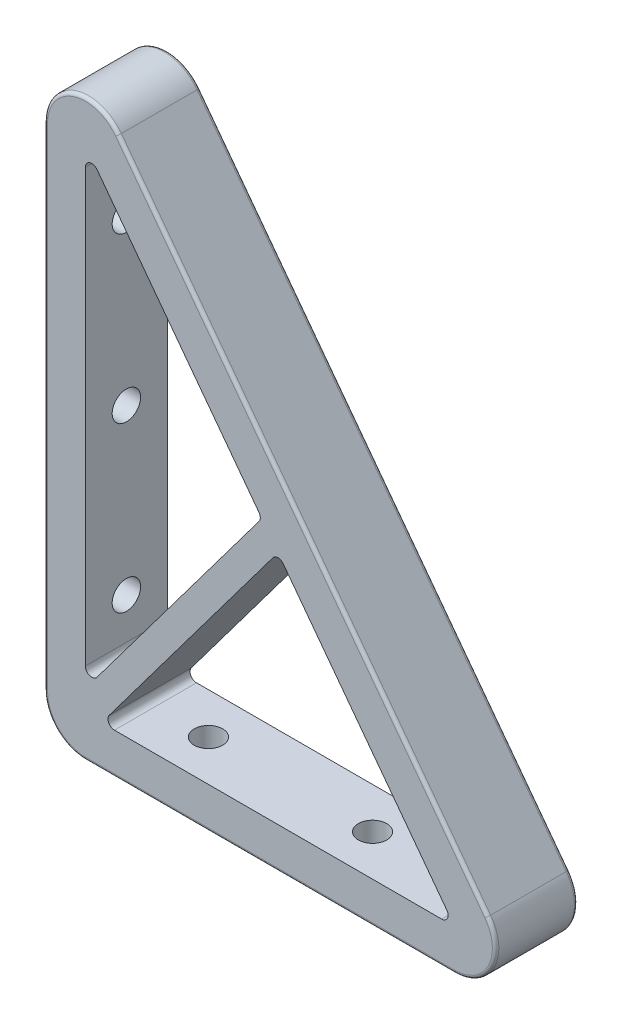
from build123d import *

# Parameters (mm, degrees)
BOSS_EXTRUDE1_DEPTH = 12.7
FILLET1_R           = 6.35
FILLET2_R           = 1
CUT_EXTRUDE1_REACH  = 115.77
SKETCH2_R           = 2.2
CUT_EXTRUDE2_REACH  = 125.947
SKETCH3_R           = 2.2
FILLET3_R           = 0.5


with BuildPart() as part:
    # Sketch1 → Boss-Extrude1 (new body)
    with BuildSketch(Plane.XY):
        Polygon((76.2, -101.6), (0, 0), (0, -101.6), align=None)
        Polygon((6.35, -91.916666667), (6.35, -19.05), (33.675, -55.483333333), align=None, mode=Mode.SUBTRACT)
        Polygon((63.5, -95.25), (8.85, -95.25), (36.175, -58.816666667), align=None, mode=Mode.SUBTRACT)
    extrude(amount=BOSS_EXTRUDE1_DEPTH)

    # Fillet1
    fillet1_edges = [part.edges().sort_by_distance(p)[0] for p in [
        (0, 0, 6.35),
        (76.2, -101.6, 6.35),
        (0, -101.6, 6.35),
    ]]
    fillet(fillet1_edges, radius=FILLET1_R)

    # Fillet2
    fillet2_edges = [part.edges().sort_by_distance(p)[0] for p in [
        (63.5, -95.25, 6.35),
        (6.35, -19.05, 6.35),
        (36.175, -58.816666667, 6.35),
        (33.675, -55.483333333, 6.35),
        (6.35, -91.916666667, 6.35),
        (8.85, -95.25, 6.35),
    ]]
    fillet(fillet2_edges, radius=FILLET2_R)

    # Sketch2 → Cut-Extrude1 (cut, up to next)
    with BuildSketch(Plane.XZ.offset(101.6), mode=Mode.PRIVATE) as cut_extrude1_sk1:
        with Locations((19.05, 6.35)):
            Circle(SKETCH2_R)
    cut_extrude1_tool1 = extrude(cut_extrude1_sk1.sketch, amount=-CUT_EXTRUDE1_REACH, mode=Mode.PRIVATE) & part.part
    # Sketch2 → Cut-Extrude1 (cut, up to next)
    with BuildSketch(Plane.XZ.offset(101.6), mode=Mode.PRIVATE) as cut_extrude1_sk2:
        with Locations((44.45, 6.35)):
            Circle(SKETCH2_R)
    cut_extrude1_tool2 = extrude(cut_extrude1_sk2.sketch, amount=-CUT_EXTRUDE1_REACH, mode=Mode.PRIVATE) & part.part
    add(cut_extrude1_tool1.solids().sort_by_distance((19.05, -101.6, 6.35))[0], mode=Mode.SUBTRACT)
    add(cut_extrude1_tool2.solids().sort_by_distance((44.45, -101.6, 6.35))[0], mode=Mode.SUBTRACT)

    # Sketch3 → Cut-Extrude2 (cut, up to next)
    with BuildSketch(Plane.ZY, mode=Mode.PRIVATE) as cut_extrude2_sk1:
        with Locations((6.35, -82.55)):
            Circle(SKETCH3_R)
    cut_extrude2_tool1 = extrude(cut_extrude2_sk1.sketch, amount=-CUT_EXTRUDE2_REACH, mode=Mode.PRIVATE) & part.part
    # Sketch3 → Cut-Extrude2 (cut, up to next)
    with BuildSketch(Plane.ZY, mode=Mode.PRIVATE) as cut_extrude2_sk2:
        with Locations((6.35, -57.15)):
            Circle(SKETCH3_R)
    cut_extrude2_tool2 = extrude(cut_extrude2_sk2.sketch, amount=-CUT_EXTRUDE2_REACH, mode=Mode.PRIVATE) & part.part
    # Sketch3 → Cut-Extrude2 (cut, up to next)
    with BuildSketch(Plane.ZY, mode=Mode.PRIVATE) as cut_extrude2_sk3:
        with Locations((6.35, -31.75)):
            Circle(SKETCH3_R)
    cut_extrude2_tool3 = extrude(cut_extrude2_sk3.sketch, amount=-CUT_EXTRUDE2_REACH, mode=Mode.PRIVATE) & part.part
    add(cut_extrude2_tool1.solids().sort_by_distance((0, -82.55, 6.35))[0], mode=Mode.SUBTRACT)
    add(cut_extrude2_tool2.solids().sort_by_distance((0, -57.15, 6.35))[0], mode=Mode.SUBTRACT)
    add(cut_extrude2_tool3.solids().sort_by_distance((0, -31.75, 6.35))[0], mode=Mode.SUBTRACT)

    # Fillet3
    fillet3_edges = [part.edges().sort_by_distance(p)[0] for p in [
        (4.341953686, -13.025861057, 0),
        (40.005, -53.34, 0),
        (69.179612663, -98.089806331, 0),
        (34.925, -101.6, 0),
        (1.859871939, -99.740128061, 0),
        (4.341953686, -13.025861057, 12.7),
        (0, -57.15, 12.7),
        (1.859871939, -99.740128061, 12.7),
        (34.925, -101.6, 12.7),
        (69.179612663, -98.089806331, 12.7),
        (0, -57.15, 0),
        (40.005, -53.34, 12.7),
    ]]
    fillet(fillet3_edges, radius=FILLET3_R)


solid = part.part
